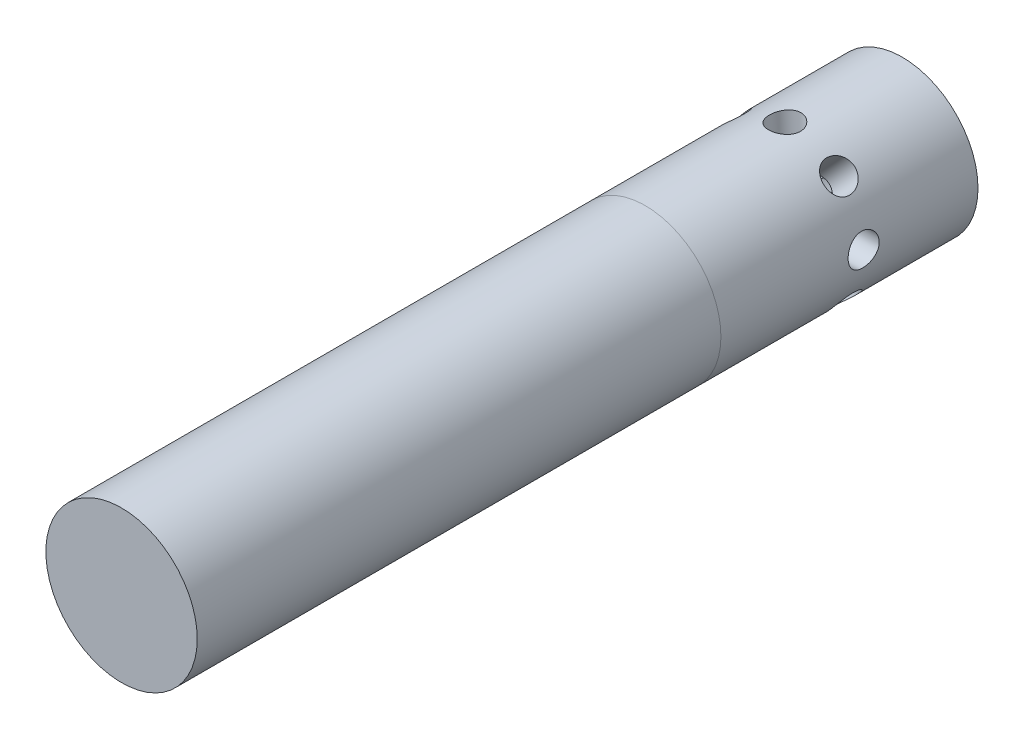
from build123d import *

# Parameters (mm, degrees)
SKETCH1_R              = 19.875
BOSS_EXTRUDE1_DEPTH    = 205
SKETCH3_R              = 10
CUT_EXTRUDE1_DEPTH     = 50
SKETCH6_R              = 4.075854405
CUT_EXTRUDE2_DEPTH     = 10
CIRPATTERN1_COUNT      = 8
SPLIT2_SURFACE_1_BACK  = 213.568
SPLIT2_SURFACE_1_DEPTH = 427.136
SPLIT2_SURFACE_2_BACK  = 213.568
SPLIT2_SURFACE_2_DEPTH = 427.136


with BuildPart() as part:
    # Sketch1 → Boss-Extrude1 (new body)
    with BuildSketch(Plane.XY):
        Circle(SKETCH1_R)
    extrude(amount=-BOSS_EXTRUDE1_DEPTH)

    # Sketch3 → Cut-Extrude1 (cut)
    with BuildSketch(Plane(origin=(0, 0, -205), x_dir=(-1, 0, 0), z_dir=(0, 0, -1))):
        Circle(SKETCH3_R)
    extrude(amount=-CUT_EXTRUDE1_DEPTH, mode=Mode.SUBTRACT)

    # Sketch6 → Cut-Extrude2 (cut)
    with BuildSketch(Plane(origin=(0.842167668, -19.857149307, -205), x_dir=(-0.9991018519472621, -0.042373216016148636, 0), z_dir=(0.042373216016148636, -0.9991018519472621, 0))):
        with Locations((0, -30)):
            Circle(SKETCH6_R)
    cut_extrude2 = extrude(amount=-CUT_EXTRUDE2_DEPTH, mode=Mode.SUBTRACT)

    # CirPattern1: Cut-Extrude2 ×8 about axis
    cirpattern1_axis = Axis((0, 0, -205), (0, 0, 1))
    for i in range(1, CIRPATTERN1_COUNT):
        add(cut_extrude2.rotate(cirpattern1_axis, i * 360 / CIRPATTERN1_COUNT), mode=Mode.SUBTRACT)


with BuildPart() as body_2:
    # Split2: the piece behind the surface
    add(part.part)
    # Split2 surface: a surface, the sketch's curves swept straight by 427.136 mm
    with BuildLine(Plane.XZ.offset(-SPLIT2_SURFACE_1_BACK), mode=Mode.PRIVATE) as split2_surface_1_path:
        Line((19.875, -137.5), (-19.875, -137.5))
    split2_surface_1 = Shell.extrude(split2_surface_1_path.wire(), (0 * SPLIT2_SURFACE_1_DEPTH, -1 * SPLIT2_SURFACE_1_DEPTH, 0 * SPLIT2_SURFACE_1_DEPTH))
    split(bisect_by=split2_surface_1, keep=Keep.BOTTOM)


with BuildPart() as part_1:
    add(part.part)

    # Split2: split by a surface, the side it looks to stays
    # Split2 surface: a surface, the sketch's curves swept straight by 427.136 mm
    with BuildLine(Plane.XZ.offset(-SPLIT2_SURFACE_2_BACK), mode=Mode.PRIVATE) as split2_surface_2_path:
        Line((19.875, -137.5), (-19.875, -137.5))
    split2_surface_2 = Shell.extrude(split2_surface_2_path.wire(), (0 * SPLIT2_SURFACE_2_DEPTH, -1 * SPLIT2_SURFACE_2_DEPTH, 0 * SPLIT2_SURFACE_2_DEPTH))
    split(bisect_by=split2_surface_2, keep=Keep.TOP)


solid = Compound([body_2.part, part_1.part])
